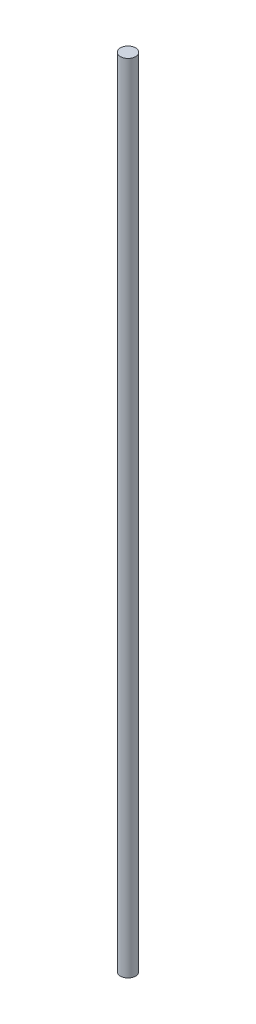
from build123d import *

# Parameters (mm, degrees)
SKETCH1_R           = 5
BOSS_EXTRUDE1_DEPTH = 524


with BuildPart() as part:
    # Sketch1 → Boss-Extrude1 (new body)
    with BuildSketch(Plane(origin=(0, 0, 0), x_dir=(1, 0, 0), z_dir=(0, 1, 0))):
        Circle(SKETCH1_R)
    extrude(amount=BOSS_EXTRUDE1_DEPTH)


solid = part.part
